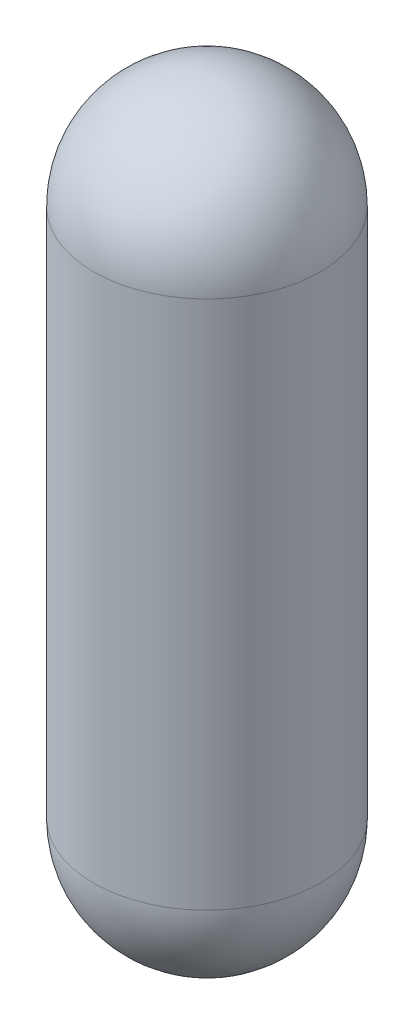
from build123d import *

# Parameters (mm, degrees)
SKETCH1_R           = 15
BOSS_EXTRUDE1_DEPTH = 70


with BuildPart() as part:
    # Sketch1 → Boss-Extrude1 (new body)
    with BuildSketch(Plane(origin=(0, 110.196823778, 0), x_dir=(1, 0, 0), z_dir=(0, 1, 0))):
        with Locations((110.196823778, -15)):
            Circle(SKETCH1_R)
    extrude(amount=BOSS_EXTRUDE1_DEPTH)

    # Sketch2 → Revolve1 (revolve)
    with BuildSketch(Plane(origin=(110.196823778, 0, 0), x_dir=(0, 0, -1), z_dir=(1, 0, 0))):
        with BuildLine():
            Line((-30, 180.196823778), (0, 180.196823778))
            ThreePointArc((0, 180.196823778), (-15, 195.196823778), (-30, 180.196823778))
        make_face()
    revolve(axis=Axis((110.196823778, 180.196823778, 0), (0, 0, 1)))

    # Sketch2<3> → Revolve2 (revolve)
    with BuildSketch(Plane(origin=(110.196823778, 0, 0), x_dir=(0, 0, -1), z_dir=(1, 0, 0))):
        with BuildLine():
            Line((0, 110.196823778), (-30, 110.196823778))
            ThreePointArc((-30, 110.196823778), (-15, 95.196823778), (0, 110.196823778))
        make_face()
    revolve(axis=Axis((110.196823778, 110.196823778, 30), (0, 0, -1)))


solid = part.part
